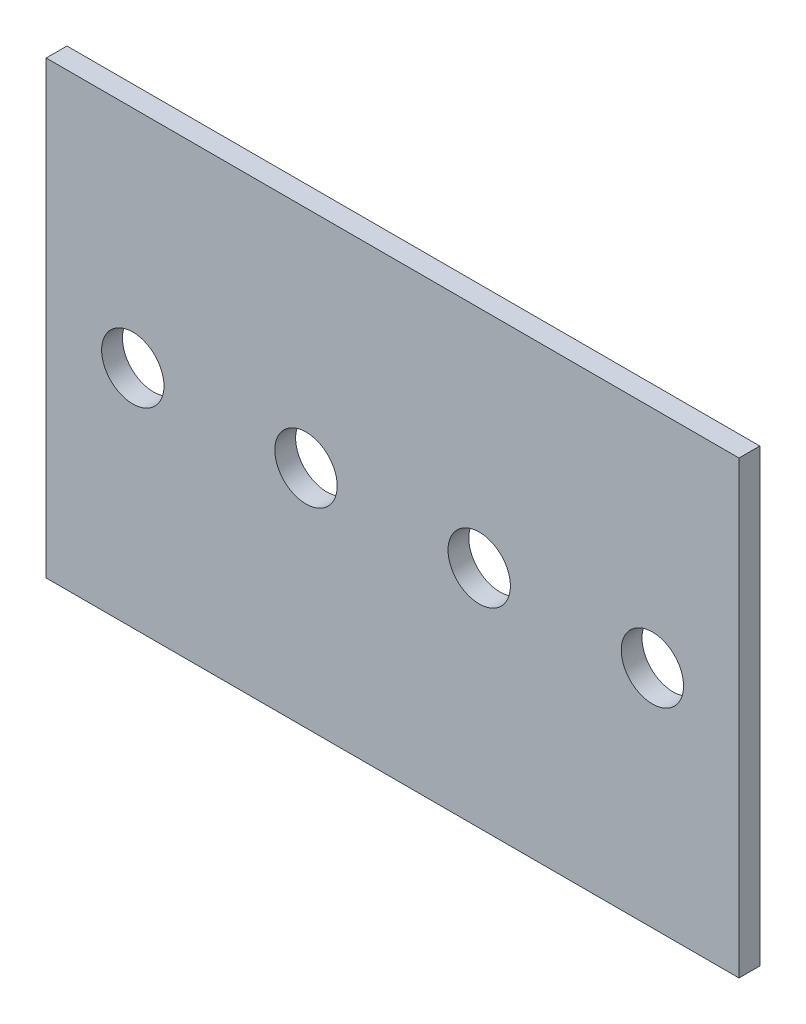
from build123d import *

# Parameters (mm, degrees)
SKETCH_1_W             = 200
SKETCH_1_H             = 130
SKETCH_1_R             = 9
SM_BASE_FLANGE_1_DEPTH = 6


# Sheet-metal steps are written as plain solids
with BuildPart() as part:
    # Sketch 1 → Базовая кромка1 (new body)
    with BuildSketch(Plane.XY):
        with Locations((100, -65)):
            Rectangle(SKETCH_1_W, SKETCH_1_H)
        with Locations((75, -65)):
            Circle(SKETCH_1_R, mode=Mode.SUBTRACT)
        with Locations((25, -65)):
            Circle(SKETCH_1_R, mode=Mode.SUBTRACT)
        with Locations(Location((125, -65, 0), (0, 0, 180))):
            Circle(SKETCH_1_R, mode=Mode.SUBTRACT)
        with Locations(Location((175, -65, 0), (0, 0, 180))):
            Circle(SKETCH_1_R, mode=Mode.SUBTRACT)
    extrude(amount=-SM_BASE_FLANGE_1_DEPTH)


solid = part.part
